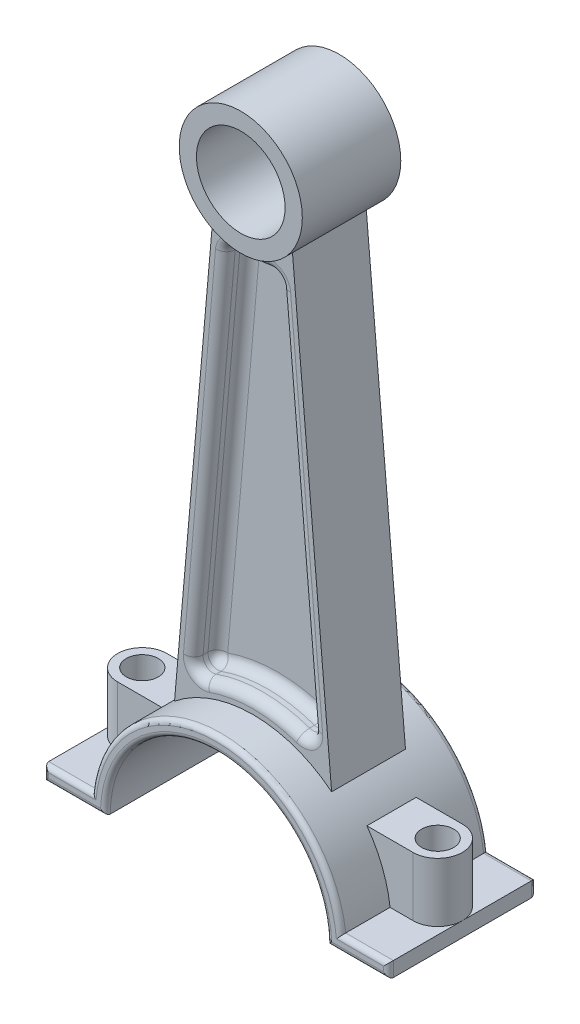
from build123d import *

# Parameters (mm, degrees)
SKETCH1_R           = 12.5
SKETCH1_R_2         = 9
BOSS_EXTRUDE1_DEPTH = 10
BOSS_EXTRUDE2_DEPTH = 15
BOSS_EXTRUDE3_DEPTH = 7.5
CUT_EXTRUDE1_START  = 7.5
CUT_EXTRUDE1_DEPTH  = 5
CUT_EXTRUDE2_START  = 12
SKETCH3_6_R         = 3.25
CUT_EXTRUDE2_DEPTH  = 148.366207046
FILLET1_R           = 2
FILLET2_R           = 2
FILLET3_R           = 1


with BuildPart() as part:
    # Sketch1 → Boss-Extrude1 (new, symmetric)
    with BuildSketch(Plane.XY):
        Circle(SKETCH1_R)
        Circle(SKETCH1_R_2, mode=Mode.SUBTRACT)
    extrude(amount=BOSS_EXTRUDE1_DEPTH, both=True)



with BuildPart() as body_2:
    # Sketch1<3> → Boss-Extrude2 (new, symmetric)
    with BuildSketch(Plane.XY):
        with BuildLine():
            Line((25.322914524, -117.4), (35, -117.4))
            Line((35, -117.4), (35, -120.4))
            Line((35, -120.4), (22.5, -120.4))
            ThreePointArc((22.5, -120.4), (0, -97.9), (-22.5, -120.4))
            Line((-22.5, -120.4), (-35, -120.4))
            Line((-35, -120.4), (-35, -117.4))
            Line((-35, -117.4), (-25.322914524, -117.4))
            ThreePointArc((-25.322914524, -117.4), (0, -94.9), (25.322914524, -117.4))
        make_face()
    extrude(amount=BOSS_EXTRUDE2_DEPTH, both=True)


with BuildPart() as part_1:
    add(part.part)

    add(body_2.part)  # Boss-Extrude3 merges body 2
    # Sketch1<4> → Boss-Extrude3 (add, symmetric)
    with BuildSketch(Plane.XY):
        with BuildLine():
            Line((-8, -9.604686356), (-15.952867936, -100.506382817))
            ThreePointArc((-15.952867936, -100.506382817), (0, -94.9), (15.952867936, -100.506382817))
            Line((15.952867936, -100.506382817), (8, -9.604686356))
            ThreePointArc((8, -9.604686356), (0, -12.5), (-8, -9.604686356))
        make_face()
    extrude(amount=BOSS_EXTRUDE3_DEPTH, both=True)

    # Sketch2 → Cut-Extrude1 (cut)
    with BuildSketch(Plane.XY.offset(CUT_EXTRUDE1_START)):
        with BuildLine():
            Line((12.438451255, -94.757556076), (5.4187458, -14.521955583))
            ThreePointArc((5.4187458, -14.521955583), (0, -15.5), (-5.4187458, -14.521955583))
            Line((-5.4187458, -14.521955583), (-12.438451255, -94.757556076))
            ThreePointArc((-12.438451255, -94.757556076), (0, -91.9), (12.438451255, -94.757556076))
        make_face()
    cut_extrude1 = extrude(amount=-CUT_EXTRUDE1_DEPTH, mode=Mode.SUBTRACT)

    # Mirror1: Cut-Extrude1 across plane
    add(cut_extrude1.mirror(Plane.XY), mode=Mode.SUBTRACT)

    # Boss-Extrude5: read off the stored shape, not the designer's step
    # Boss-Extrude5: loft between two sections, ruled curve by curve
    boss_extrude5_from = [
        Edge.make_three_point_arc((30, -117.4, 5), (33.535533906, -117.4, 3.535533906), (35, -117.4, 0)),
        Edge.make_three_point_arc((35, -117.4, 0), (33.535533906, -117.4, -3.535533906), (30, -117.4, -5)),
        Edge.make_line((25.322914524, -117.4, 5), (30, -117.4, 5)),
        Edge.make_line((25.322914524, -117.4, -5), (30, -117.4, -5)),
        Edge.make_line((25.322914524, -117.4, -5), (25.322914524, -117.4, 5)),
    ]
    boss_extrude5_to = [
        Edge.make_three_point_arc((30, -105.4, 5), (33.535533906, -105.4, 3.535533906), (35, -105.4, 0)),
        Edge.make_three_point_arc((35, -105.4, 0), (33.535533906, -105.4, -3.535533906), (30, -105.4, -5)),
        Edge.make_line((20.621590627, -105.4, 5), (30, -105.4, 5)),
        Edge.make_line((20.621590627, -105.4, -5), (30, -105.4, -5)),
        Edge.make_line((20.621590627, -105.4, -5), (20.621590627, -105.4, 5)),
    ]
    boss_extrude5 = Solid(Shell([*[Face.make_surface_from_curves(boss_extrude5_from[k], boss_extrude5_to[k]) for k in range(5)], Face(Wire(boss_extrude5_from)), Face(Wire(boss_extrude5_to))]))
    add(boss_extrude5)

    # Sketch3<6> → Cut-Extrude2 (cut, through all)
    with BuildSketch(Plane(origin=(0, -117.4, 0), x_dir=(1, 0, 0), z_dir=(0, 1, 0)).offset(CUT_EXTRUDE2_START)):
        with Locations(Location((30, 0, 0), (0, 0, 270))):
            Circle(SKETCH3_6_R)
    cut_extrude2 = extrude(amount=-CUT_EXTRUDE2_DEPTH, mode=Mode.SUBTRACT)

    # Mirror2: Boss-Extrude5, Cut-Extrude2 across plane
    add(boss_extrude5.mirror(Plane(origin=(0, 0, 0), x_dir=(0, 0, 1), z_dir=(1, 0, 0))))
    add(cut_extrude2.mirror(Plane(origin=(0, 0, 0), x_dir=(0, 0, 1), z_dir=(1, 0, 0))), mode=Mode.SUBTRACT)

    # Fillet1
    fillet1_edges = [part_1.edges().sort_by_distance(p)[0] for p in [
        (5.4187458, -14.521955583, 5),
        (0, -91.9, 7.5),
        (12.438451255, -94.757556076, 5),
        (-12.438451255, -94.757556076, 5),
        (0, -15.5, 7.5),
        (-5.4187458, -14.521955583, 5),
        (8.928598527, -54.63975583, 7.5),
        (-8.928598527, -54.63975583, 7.5),
        (8.928598527, -54.63975583, -7.5),
        (12.438451255, -94.757556076, -5),
        (0, -15.5, -2.5),
        (5.4187458, -14.521955583, -5),
        (-8.928598527, -54.63975583, -7.5),
        (-5.4187458, -14.521955583, -5),
        (0, -91.9, -2.5),
        (-12.438451255, -94.757556076, -5),
        (8.928598527, -54.63975583, -2.5),
        (-8.928598527, -54.63975583, -2.5),
        (0, -91.9, -7.5),
        (0, -15.5, -7.5),
    ]]
    fillet(fillet1_edges, radius=FILLET1_R)

    # Fillet2
    fillet2_edges = [part_1.edges().sort_by_distance(p)[0] for p in [
        (8.890577122, -54.205169173, 2.5),
        (0, -15.5, 2.5),
        (0, -91.9, 2.5),
        (-8.890577122, -54.205169173, 2.5),
        (-11.383241655, -93.22221471, 2.5),
        (11.383241655, -93.22221471, 2.5),
        (-4.827856438, -15.509932534, 2.5),
        (4.827856438, -15.509932534, 2.5),
    ]]
    fillet(fillet2_edges, radius=FILLET2_R)

    # Fillet3
    fillet3_edges = [part_1.edges().sort_by_distance(p)[0] for p in [
        (30.161457262, -117.4, 15),
        (0, -94.9, -15),
        (-30.161457262, -117.4, 15),
        (-35, -118.9, -15),
        (-28.75, -120.4, -15),
        (0, -97.9, 15),
        (28.75, -120.4, -15),
        (35, -118.9, 15),
        (0, -94.9, 15),
        (-35, -118.9, 15),
        (-28.75, -120.4, 15),
        (28.75, -120.4, 15),
        (30.161457262, -117.4, -15),
        (35, -118.9, -15),
        (0, -97.9, -15),
        (-30.161457262, -117.4, -15),
    ]]
    fillet(fillet3_edges, radius=FILLET3_R)


solid = part_1.part
